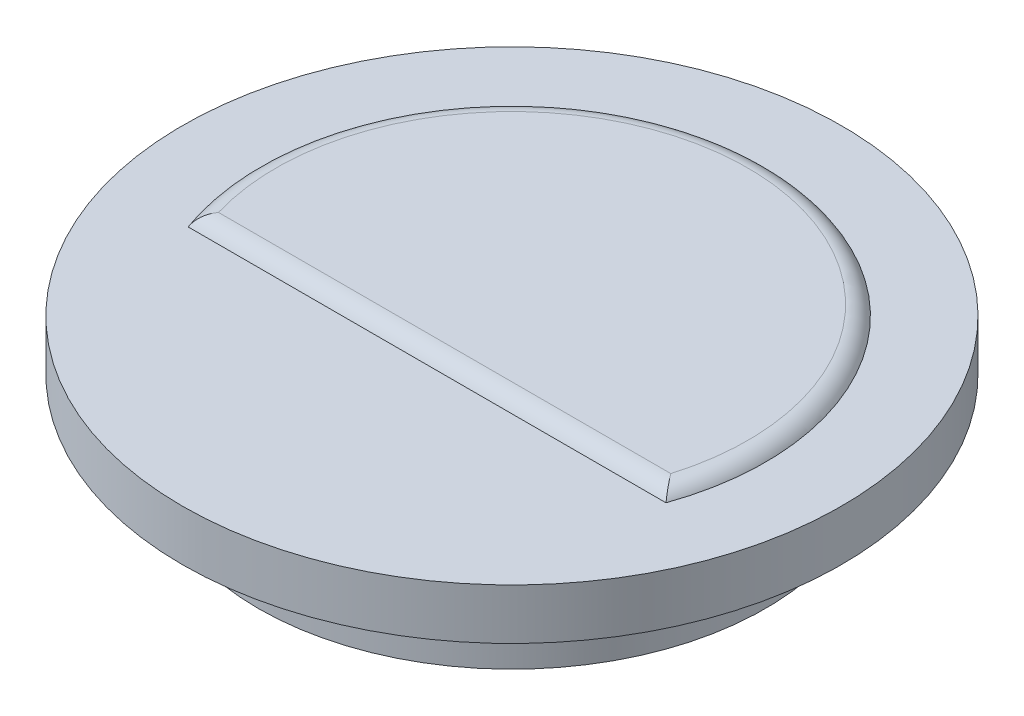
from build123d import *

# Parameters (mm, degrees)
SKETCH1_R           = 65
BOSS_EXTRUDE1_DEPTH = 10
BOSS_EXTRUDE2_DEPTH = 2
FILLET1_R           = 4
SKETCH3_R           = 50
BOSS_EXTRUDE8_DEPTH = 15


with BuildPart() as part:
    # Sketch1 → Boss-Extrude1 (new body)
    with BuildSketch(Plane(origin=(0, 0, 0), x_dir=(1, 0, 0), z_dir=(0, 1, 0))):
        with Locations(Location((0, 0, 0), (0, 0, 270))):
            Circle(SKETCH1_R)
        with BuildLine():
            Line((-47.117303386, -16.731996941), (47.117303386, -16.731996941))
            ThreePointArc((47.117303386, -16.731996941), (0, 50), (-47.117303386, -16.731996941))
        make_face(mode=Mode.SUBTRACT)
    extrude(amount=BOSS_EXTRUDE1_DEPTH)


with BuildPart() as body_2:
    # Sketch2 → Boss-Extrude2 (new body)
    with BuildSketch(Plane(origin=(0, 10, 0), x_dir=(1, 0, 0), z_dir=(0, 1, 0))):
        with BuildLine():
            Line((-47.117303386, -16.731996941), (47.117303386, -16.731996941))
            ThreePointArc((47.117303386, -16.731996941), (0, 50), (-47.117303386, -16.731996941))
        make_face()
    extrude(amount=BOSS_EXTRUDE2_DEPTH)

    # Fillet1
    # the kernel refuses this fillet: 4 mm, written as the material it takes off along each edge
    with BuildSketch(Plane(origin=(-55.777557424, 12, 16.731996941), x_dir=(0, -1, 0), z_dir=(1, 0, 0))) as fillet1_piece_1:
        with BuildLine():
            CenterArc((4, 3.464101615), FILLET1_R, 180, 60)
            Line((0, 3.464101615), (-0.08, 3.464101615))
            Line((-0.08, 3.464101615), (-0.08, 0))
            Line((-0.08, 0), (0, -0.08))
            ThreePointArc((0, -0.08), (1, -0.08), (1.96, -0.069282032))
            Line((1.96, -0.069282032), (2, 0))
        make_face()
    extrude(amount=111.555114848, mode=Mode.SUBTRACT)
    with BuildSketch(Plane(origin=(0, 12, 0), x_dir=(0.8703709621505415, 0, 0.49239657619152943), z_dir=(-0.49239657619152943, 0, 0.8703709621505415))) as fillet1_piece_2:
        with BuildLine():
            CenterArc((46.535898385, -4), FILLET1_R, 30, 60)
            Line((46.535898385, 0), (46.535898385, 0.08))
            Line((46.535898385, 0.08), (50, 0.08))
            Line((50, 0.08), (50.08, 0))
            ThreePointArc((50.08, 0), (50.08, -1), (50.069282032, -1.96))
            Line((50.069282032, -1.96), (50, -2))
        make_face()
    revolve(axis=Axis((0, 12, 0), (0, 1, 0)), revolution_arc=238.996447313, mode=Mode.SUBTRACT)


with BuildPart() as body_3:
    # Sketch3 → Boss-Extrude8 (new body)
    with BuildSketch(Plane.XZ):
        with Locations(Location((0, 0, 0), (0, 0, 270))):
            Circle(SKETCH3_R)
    extrude(amount=BOSS_EXTRUDE8_DEPTH)


solid = Compound([part.part, body_2.part, body_3.part])
